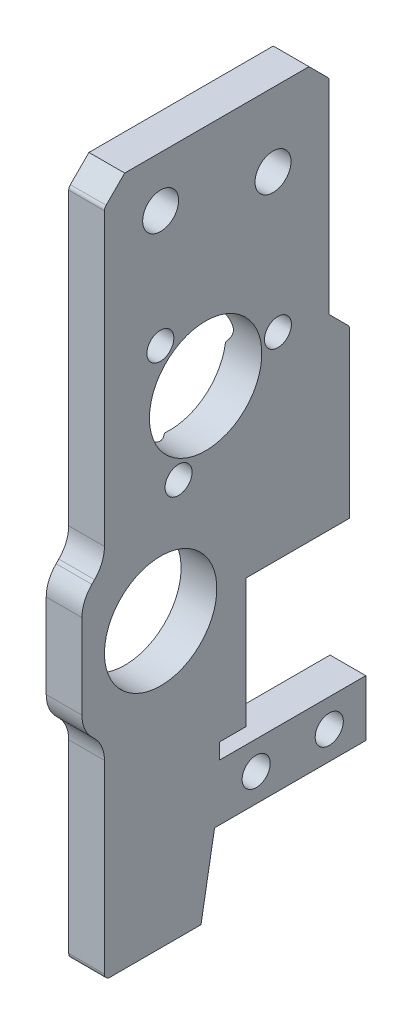
from build123d import *

# Parameters (mm, degrees)
SKETCH1_R                                       = 5
SKETCH1_R_2                                     = 1.6
SKETCH1_R_3                                     = 1.25
BOSS_EXTRUDE1_DEPTH                             = 3.18
CHAMFER1_SIZE                                   = 8
CHAMFER1_SIZE_2                                 = 1.410615846
CSK_FOR_M2_FLAT_HEAD_MACHINE_SCREW1_D           = 2.4
CSK_FOR_M2_FLAT_HEAD_MACHINE_SCREW1_DEPTH       = 3.508967257
CSK_FOR_M2_FLAT_HEAD_MACHINE_SCREW1_CSINK_D     = 4.4
CSK_FOR_M2_FLAT_HEAD_MACHINE_SCREW1_CSINK_ANGLE = 90
CSK_FOR_M2_FLAT_HEAD_MACHINE_SCREW1_TIP         = 0.721032743
SKETCH3_R                                       = 5
CUT_EXTRUDE4_DEPTH                              = 66.647475199
FILLET2_R                                       = 3
CHAMFER2_SIZE                                   = 1.8
FILLET4_R                                       = 0.5


# Some blends are built 0.0001 mm under size
with BuildPart() as part:
    # Sketch1 → Boss-Extrude1 (new body)
    with BuildSketch(Plane(origin=(0, 0, 0), x_dir=(0, 0, -1), z_dir=(1, 0, 0))):
        Polygon((0, 0), (0, 18.2), (-2, 20.2), (-2, 30.2), (0, 32.2), (0, 61.31), (20, 61.31), (20, 41.31), (21.8, 41.31), (21.8, 24.71), (12.6, 24.71), (12.6, 13.26), (10.25, 13.26), (10.25, 11.86), (23.25, 11.86), (23.25, 6.86), (10, 6.86), (10, 0), align=None)
        with Locations(Location((5, 25.2, 0), (0, 0, 180))):
            Circle(SKETCH1_R, mode=Mode.SUBTRACT)
        with Locations(Location((5, 56.81, 0), (0, 0, 180))):
            Circle(SKETCH1_R_2, mode=Mode.SUBTRACT)
        with Locations(Location((15, 54.81, 0), (0, 0, 180))):
            Circle(SKETCH1_R_2, mode=Mode.SUBTRACT)
        with Locations(Location((20, 9.36, 0), (0, 0, 180))):
            Circle(SKETCH1_R_3, mode=Mode.SUBTRACT)
        with Locations(Location((13.5, 9.36, 0), (0, 0, 180))):
            Circle(SKETCH1_R_3, mode=Mode.SUBTRACT)
    extrude(amount=BOSS_EXTRUDE1_DEPTH)

    # Chamfer1
    # the kernel refuses this chamfer: 8, 1.410615846 mm, written as the material it takes off along each edge
    with BuildSketch(Plane(origin=(-20.788310371, 0, -10), x_dir=(0, 0.9999776716360547, -0.006682531656101032), z_dir=(1, 0, 0))) as chamfer1_piece_1_section:
        Polygon((CHAMFER1_SIZE * 0.999977671636, CHAMFER1_SIZE * 0.0066825316561), (-CHAMFER1_SIZE_2 * 0.00668253165453, CHAMFER1_SIZE_2 * 0.999977671401), (0, 0), align=None)
    chamfer1_piece_1 = extrude(amount=44.756620743, mode=Mode.PRIVATE)
    chamfer1_piece_1 = split(chamfer1_piece_1, bisect_by=Plane(origin=(1.59, 6.86, -9.594110318), z_dir=(0, -1, 0)), keep=Keep.TOP, mode=Mode.PRIVATE)
    add(chamfer1_piece_1, mode=Mode.SUBTRACT)

    # CSK for M2 Flat Head Machine Screw1
    with Locations(Plane.ZY):
        with Locations((-4.974936087, 46.414674329), (-15.432559713, 42.244769284), (-6.592504199, 35.273154083)):
            CounterSinkHole(CSK_FOR_M2_FLAT_HEAD_MACHINE_SCREW1_D / 2, CSK_FOR_M2_FLAT_HEAD_MACHINE_SCREW1_CSINK_D / 2, depth=CSK_FOR_M2_FLAT_HEAD_MACHINE_SCREW1_DEPTH, counter_sink_angle=CSK_FOR_M2_FLAT_HEAD_MACHINE_SCREW1_CSINK_ANGLE)
            with Locations((0, 0, -(CSK_FOR_M2_FLAT_HEAD_MACHINE_SCREW1_DEPTH + CSK_FOR_M2_FLAT_HEAD_MACHINE_SCREW1_TIP / 2))):  # 118° drill point
                Cone(0, CSK_FOR_M2_FLAT_HEAD_MACHINE_SCREW1_D / 2, CSK_FOR_M2_FLAT_HEAD_MACHINE_SCREW1_TIP, mode=Mode.SUBTRACT)

    # Sketch3 → Cut-Extrude4 (cut, through all)
    with BuildSketch(Plane.ZY):
        with Locations((-9, 41.310865899)):
            Circle(SKETCH3_R)
    extrude(amount=-CUT_EXTRUDE4_DEPTH, mode=Mode.SUBTRACT)

    # Fillet2
    fillet2_edges = [part.edges().sort_by_distance(p)[0] for p in [
        (1.59, 18.2, 0),
        (1.59, 20.2, 2),
        (1.59, 30.2, 2),
        (1.59, 32.2, 0),
    ]]
    fillet(fillet2_edges, radius=FILLET2_R)

    # Chamfer2
    chamfer2_edges = [part.edges().sort_by_distance(p)[0] for p in [
        (1.59, 61.31, -20),
        (1.59, 61.31, 0),
        (1.59, 41.31, -21.8),
    ]]
    chamfer(chamfer2_edges, length=CHAMFER2_SIZE - 0.0001)  # a hair under: the kernel refuses the full size

    # Fillet4
    fillet4_edges = [part.edges().sort_by_distance(p)[0] for p in [
        (1.59, 39.5101, -21.8),
        (1.59, 59.5101, -20),
        (1.59, 59.5101, 0),
        (1.59, 0, 0),
    ]]
    fillet(fillet4_edges, radius=FILLET4_R)


solid = part.part
